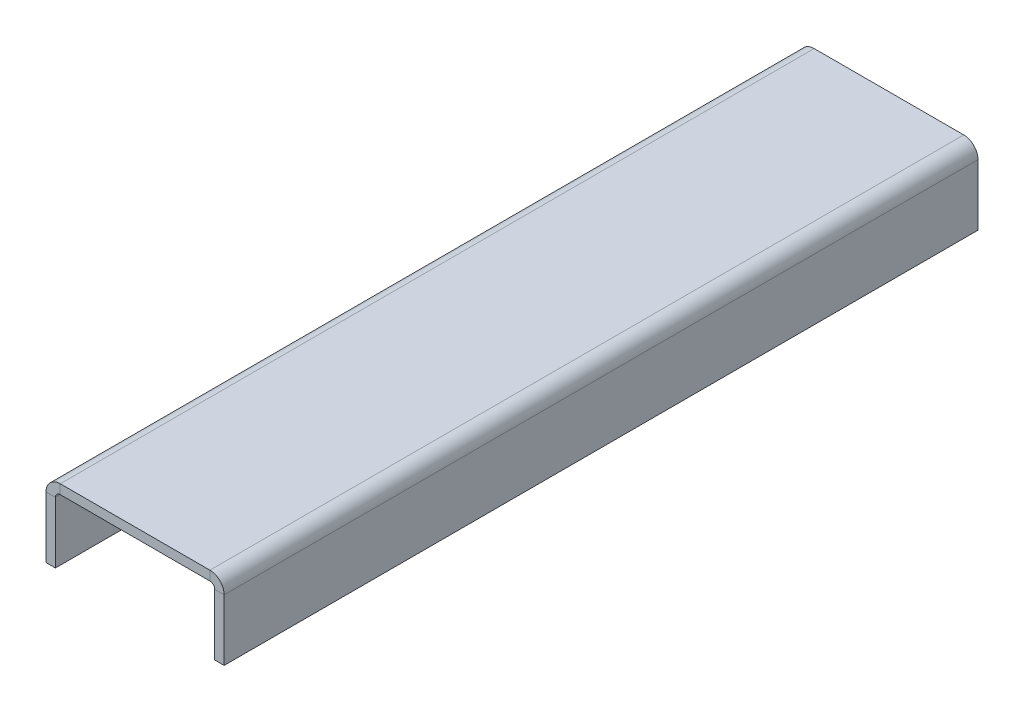
from build123d import *

# Parameters (mm, degrees)
BASE_FLANGE1_DEPTH = 127


# Sheet-metal steps are written as plain solids
with BuildPart() as part:
    # Sketch1 → Base-Flange1 (new body)
    with BuildSketch(Plane.XY):
        with BuildLine():
            Line((-15.00632, -12.7), (-15.00632, -2.4003))
            ThreePointArc((-15.00632, -2.4003), (-14.303288407, -0.703031593), (-12.60602, 0))
            Line((-12.60602, 0), (12.60602, 0))
            ThreePointArc((12.60602, 0), (14.303288407, -0.703031593), (15.00632, -2.4003))
            Line((15.00632, -2.4003), (15.00632, -12.7))
            Line((15.00632, -12.7), (13.41882, -12.7))
            Line((13.41882, -12.7), (13.41882, -2.4003))
            ThreePointArc((13.41882, -2.4003), (13.180756392, -1.825563608), (12.60602, -1.5875))
            Line((12.60602, -1.5875), (-12.60602, -1.5875))
            ThreePointArc((-12.60602, -1.5875), (-13.180756392, -1.825563608), (-13.41882, -2.4003))
            Line((-13.41882, -2.4003), (-13.41882, -12.7))
            Line((-13.41882, -12.7), (-15.00632, -12.7))
        make_face()
    extrude(amount=BASE_FLANGE1_DEPTH)


solid = part.part
